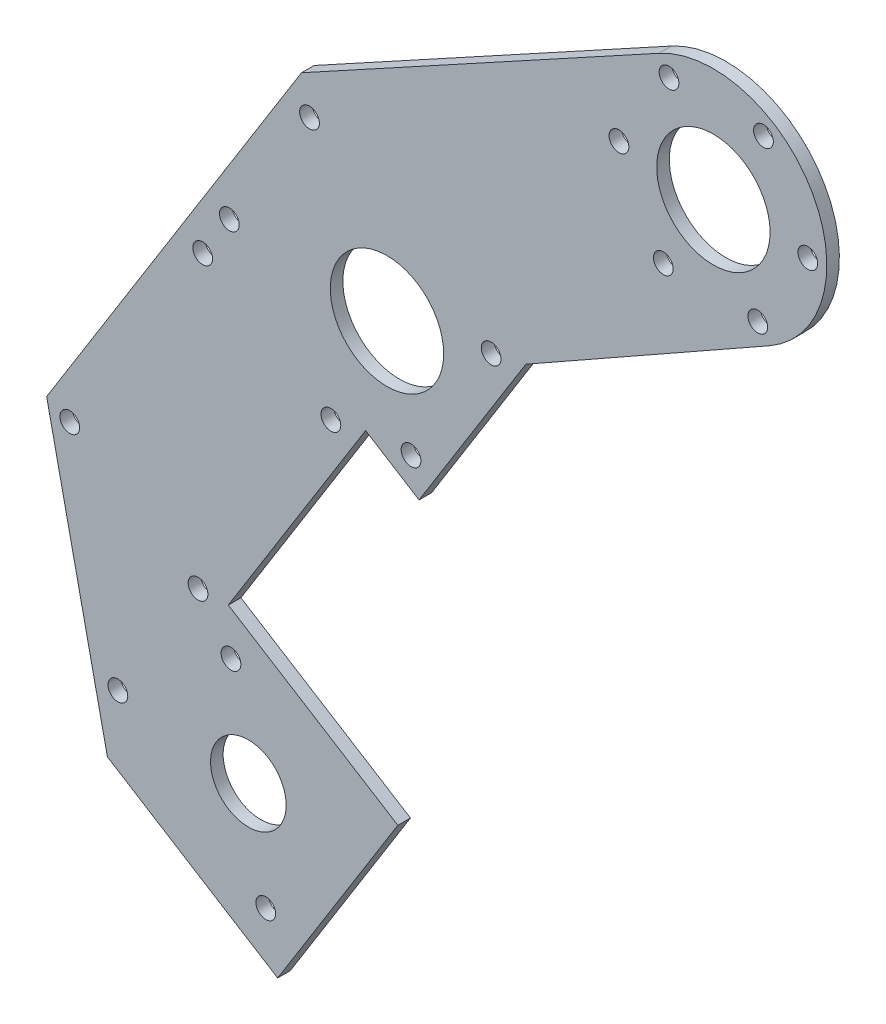
from build123d import *

# Parameters (mm, degrees)
SKETCH1_R              = 14.2875
SKETCH1_R_2            = 9.525
SKETCH1_R_3            = 14.287500001
BOSS_EXTRUDE1_DEPTH    = 3.175
F_10_CLEARANCE_HOLE2_D = 4.9784
F_10_CLEARANCE_HOLE3_D = 4.9784


with BuildPart() as part:
    # Sketch1 → Boss-Extrude1 (new body)
    with BuildSketch(Plane.XY.offset(-14.194599474)):
        with BuildLine():
            Line((-11.403602879, 461.040918113), (18.881283072, 509.506866808))
            Line((18.881283072, 509.506866808), (-23.846467356, 536.206128526))
            Line((-23.846467356, 536.206128526), (10.759214603, 591.586796266))
            Line((10.759214603, 591.586796266), (24.22197813, 583.174327946))
            Line((24.22197813, 583.174327946), (51.141876753, 626.255171231))
            Line((51.141876753, 626.255171231), (112.462044501, 660.93728694))
            ThreePointArc((112.462044501, 660.93728694), (123.365099156, 699.702028841), (84.677956887, 710.877306848))
            Line((84.677956887, 710.877306848), (-5.401730059, 661.587538174))
            Line((-5.401730059, 661.587538174), (-69.615486106, 558.824047132))
            Line((-69.615486106, 558.824047132), (-54.307899735, 487.850498283))
            Line((-54.307899735, 487.850498283), (-11.403602879, 461.040918113))
        make_face()
        with Locations((16.14150623, 618.174698631)):
            Circle(SKETCH1_R, mode=Mode.SUBTRACT)
        with Locations((-18.787612769, 499.810661233)):
            Circle(SKETCH1_R_2, mode=Mode.SUBTRACT)
        with Locations((98.394472265, 685.809641802)):
            Circle(SKETCH1_R_3, mode=Mode.SUBTRACT)
    extrude(amount=BOSS_EXTRUDE1_DEPTH)

    # #10 Clearance Hole2 (through all)
    with Locations(Plane.XY.offset(-11.019599474)):
        with Locations((-23.168465476, 524.830016332), (-14.406760063, 474.791306134), (-3.381611976, 652.837445435), (42.391784014, 624.235053148), (22.201860047, 591.924420685), (-23.571535943, 620.526812972), (-31.474844299, 535.981130963), (-63.785476762, 556.17105493), (-51.664768266, 503.670498499), (2.009121865, 589.566678183), (-30.301510599, 609.756602151)):
            Hole(F_10_CLEARANCE_HOLE2_D / 2)

    # #10 Clearance Hole3 (through all)
    with Locations(Plane.XY.offset(-11.019599474)):
        with Locations((111.013174745, 706.003787091), (122.192466334, 684.978597536), (109.573763854, 664.784452247), (85.775769786, 665.615496512), (74.596478197, 686.640686067), (87.215180676, 706.834831357)):
            Hole(F_10_CLEARANCE_HOLE3_D / 2)


solid = part.part
